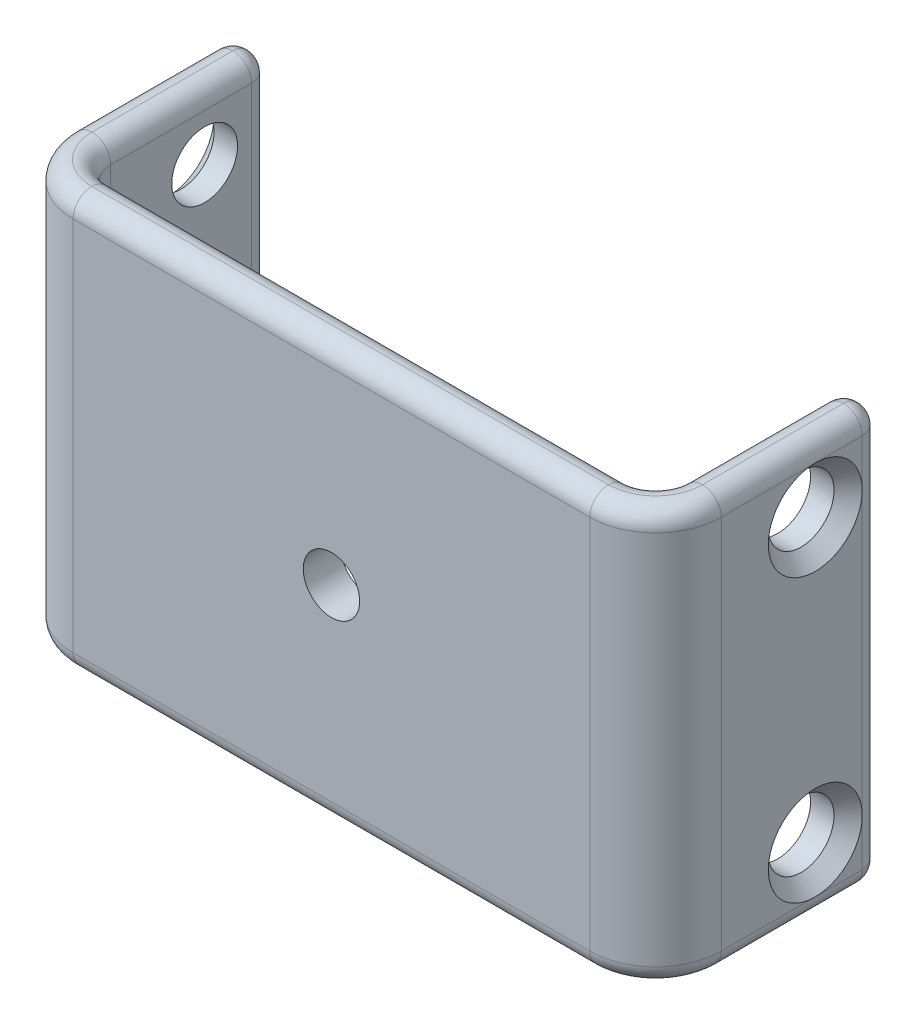
from build123d import *

# Parameters (mm, degrees)
BOSS_EXTRUDE1_DEPTH      = 11
BOSS_EXTRUDE1_DEPTH_BACK = 11
CUT_EXTRUDE1_DEPTH       = 23.154288524
CUT_EXTRUDE1_DEPTH_BACK  = 23.154288524
SKETCH2_R                = 1.75
CUT_EXTRUDE2_REACH       = 25.718
SKETCH3_R                = 1.5
FILLET1_R                = 1
CHAMFER1_SIZE            = 0.75


with BuildPart() as part:
    # Sketch1 → Boss-Extrude1 (new, two sides: drawn at the far end of the back side and taken through both)
    with BuildSketch(Plane(origin=(0, 0, 0), x_dir=(1, 0, 0), z_dir=(0, 1, 0)).offset(-BOSS_EXTRUDE1_DEPTH_BACK)):
        with BuildLine():
            Line((-15.25, 0), (-15.25, -5))
            ThreePointArc((-15.25, -5), (-14.810660172, -6.060660172), (-13.75, -6.5))
            Line((-13.75, -6.5), (13.75, -6.5))
            ThreePointArc((13.75, -6.5), (14.810660172, -6.060660172), (15.25, -5))
            Line((15.25, -5), (15.25, 0))
            Line((15.25, 0), (15.25, 3.5))
            Line((15.25, 3.5), (17.25, 3.5))
            Line((17.25, 3.5), (17.25, 0))
            Line((17.25, 0), (17.25, -5))
            ThreePointArc((17.25, -5), (16.224873734, -7.474873734), (13.75, -8.5))
            Line((13.75, -8.5), (-13.75, -8.5))
            ThreePointArc((-13.75, -8.5), (-16.224873734, -7.474873734), (-17.25, -5))
            Line((-17.25, -5), (-17.25, 0))
            Line((-17.25, 0), (-17.25, 3.5))
            Line((-17.25, 3.5), (-15.25, 3.5))
            Line((-15.25, 3.5), (-15.25, 0))
        make_face()
    extrude(amount=BOSS_EXTRUDE1_DEPTH + BOSS_EXTRUDE1_DEPTH_BACK)

    # Sketch2 → Cut-Extrude1 (cut, two sides: drawn at the far end of the back side and taken through both)
    with BuildSketch(Plane(origin=(0, 0, 0), x_dir=(0, 0, -1), z_dir=(1, 0, 0)).offset(-CUT_EXTRUDE1_DEPTH_BACK)):
        with Locations((0, 7.5)):
            Circle(SKETCH2_R)
        with Locations((0, -7.5)):
            Circle(SKETCH2_R)
    extrude(amount=CUT_EXTRUDE1_DEPTH + CUT_EXTRUDE1_DEPTH_BACK, mode=Mode.SUBTRACT)

    # Sketch3 → Cut-Extrude2 (cut, up to next)
    with BuildSketch(Plane.XY.offset(8.5), mode=Mode.PRIVATE) as cut_extrude2_sk1:
        Circle(SKETCH3_R)
    cut_extrude2_tool1 = extrude(cut_extrude2_sk1.sketch, amount=-CUT_EXTRUDE2_REACH, mode=Mode.PRIVATE) & part.part
    add(cut_extrude2_tool1.solids().sort_by_distance((0, 0, 8.5))[0], mode=Mode.SUBTRACT)

    # Fillet1
    fillet1_edges = [part.edges().sort_by_distance(p)[0] for p in [
        (-16.25, -11, -3.5),
        (-17.25, -11, 0.75),
        (-16.224873734, -11, 7.474873734),
        (0, -11, 8.5),
        (15.25, 0, -3.5),
        (17.25, 0, -3.5),
        (-17.25, 0, -3.5),
        (-15.25, 0, -3.5),
        (16.224873734, -11, 7.474873734),
        (17.25, -11, 0.75),
        (16.25, -11, -3.5),
        (-14.810660172, -11, 6.060660172),
        (15.25, -11, 0.75),
        (-14.810660172, 11, 6.060660172),
        (-15.25, 11, 0.75),
        (-16.25, 11, -3.5),
        (-17.25, 11, 0.75),
        (14.810660172, -11, 6.060660172),
        (-16.224873734, 11, 7.474873734),
        (0, 11, 8.5),
        (16.224873734, 11, 7.474873734),
        (17.25, 11, 0.75),
        (16.25, 11, -3.5),
        (15.25, 11, 0.75),
        (14.810660172, 11, 6.060660172),
        (0, 11, 6.5),
        (0, -11, 6.5),
        (-15.25, -11, 0.75),
    ]]
    fillet(fillet1_edges, radius=FILLET1_R - 0.0001)  # a hair under: the kernel refuses the full size

    # Chamfer1
    chamfer1_edges = [part.edges().sort_by_distance(p)[0] for p in [
        (-17.25, 7.5, 1.75),
        (17.25, 7.5, 1.75),
        (-17.25, -7.5, 1.75),
        (17.25, -7.5, 1.75),
    ]]
    chamfer(chamfer1_edges, length=CHAMFER1_SIZE)


solid = part.part
